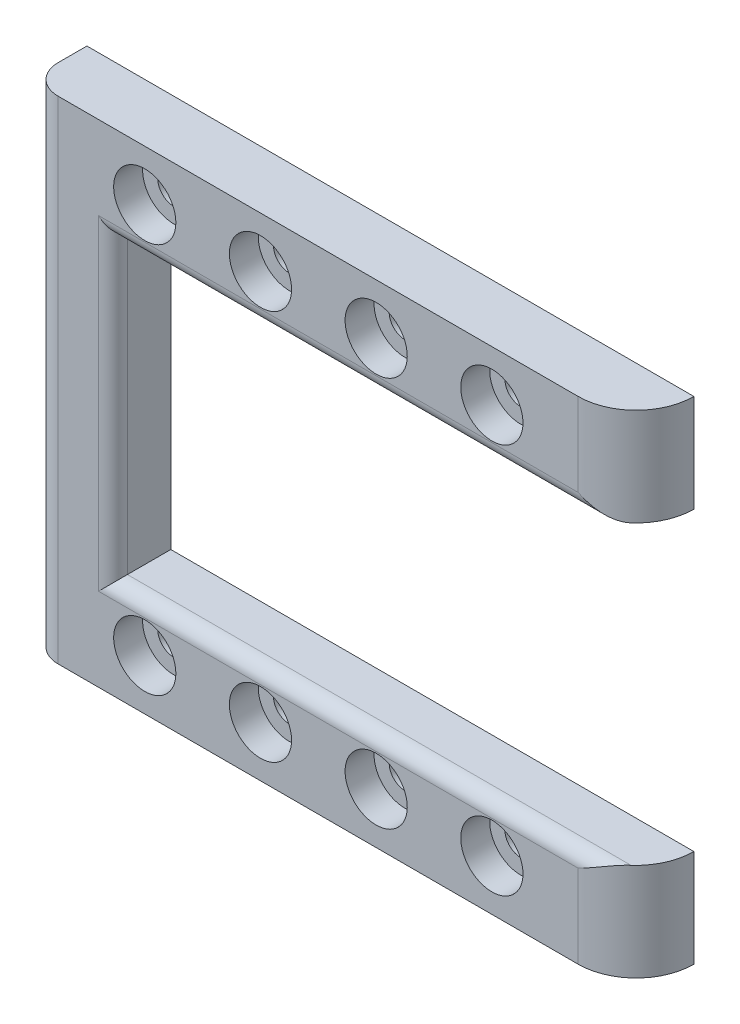
from build123d import *
from OCP.BRepFilletAPI import BRepFilletAPI_MakeFillet

# Parameters (mm, degrees)
SKETCH1_R           = 1.1
BOSS_EXTRUDE1_DEPTH = 4
SKETCH2_W           = 32.7
SKETCH2_H           = 20.5
CUT_EXTRUDE1_DEPTH  = 26.991585177
SKETCH3_R           = 2.15
CUT_EXTRUDE2_DEPTH  = 2
SKETCH6_W           = 4
SKETCH6_H           = 6.75
BOSS_EXTRUDE3_DEPTH = 3.47
FILLET1_R           = 4
FILLET1_R_2         = 2
FILLET1_R_3         = 1


with BuildPart() as part:
    # Sketch1 → Boss-Extrude1 (new body)
    with BuildSketch(Plane.XY):
        with BuildLine():
            Line((19.25, 17), (19.25, 5.6))
            ThreePointArc((19.25, 5.6), (13.65, 0), (19.25, -5.6))
            Line((19.25, -5.6), (19.25, -17))
            Line((19.25, -17), (-19.25, -17))
            Line((-19.25, -17), (-19.25, 17))
            Line((-19.25, 17), (19.25, 17))
        make_face()
        with Locations((12.75, 13.5)):
            Circle(SKETCH1_R, mode=Mode.SUBTRACT)
        with Locations((4.75, 13.5)):
            Circle(SKETCH1_R, mode=Mode.SUBTRACT)
        with Locations((-3.25, 13.5)):
            Circle(SKETCH1_R, mode=Mode.SUBTRACT)
        with Locations((-11.25, 13.5)):
            Circle(SKETCH1_R, mode=Mode.SUBTRACT)
        with Locations(Location((-11.25, -13.5, 0), (0, 0, 180))):
            Circle(SKETCH1_R, mode=Mode.SUBTRACT)
        with Locations(Location((-3.25, -13.5, 0), (0, 0, 180))):
            Circle(SKETCH1_R, mode=Mode.SUBTRACT)
        with Locations(Location((4.75, -13.5, 0), (0, 0, 180))):
            Circle(SKETCH1_R, mode=Mode.SUBTRACT)
        with Locations(Location((12.75, -13.5, 0), (0, 0, 180))):
            Circle(SKETCH1_R, mode=Mode.SUBTRACT)
    extrude(amount=BOSS_EXTRUDE1_DEPTH)

    # Sketch2 → Cut-Extrude1 (cut, through all)
    with BuildSketch(Plane.XY.offset(4)):
        with Locations((2.9, 0)):
            Rectangle(SKETCH2_W, SKETCH2_H)
    extrude(amount=-CUT_EXTRUDE1_DEPTH, mode=Mode.SUBTRACT)

    # Sketch3 → Cut-Extrude2 (cut)
    with BuildSketch(Plane.XY.offset(4)):
        with Locations((12.75, 13.5)):
            Circle(SKETCH3_R)
        with Locations((4.75, 13.5)):
            Circle(SKETCH3_R)
        with Locations((-3.25, 13.5)):
            Circle(SKETCH3_R)
        with Locations((-11.25, 13.5)):
            Circle(SKETCH3_R)
        with Locations((12.75, -13.5)):
            Circle(SKETCH3_R)
        with Locations((4.75, -13.5)):
            Circle(SKETCH3_R)
        with Locations((-3.25, -13.5)):
            Circle(SKETCH3_R)
        with Locations((-11.25, -13.5)):
            Circle(SKETCH3_R)
    extrude(amount=-CUT_EXTRUDE2_DEPTH, mode=Mode.SUBTRACT)

    # Sketch6 → Boss-Extrude3 (add)
    with BuildSketch(Plane(origin=(19.25, 0, 0), x_dir=(0, 0, -1), z_dir=(1, 0, 0))):
        with Locations((-2, -13.625)):
            Rectangle(SKETCH6_W, SKETCH6_H)
        with Locations((-2, 13.625)):
            Rectangle(SKETCH6_W, SKETCH6_H)
    extrude(amount=BOSS_EXTRUDE3_DEPTH)

    # Fillet1
    fillet1_edges_1 = [part.edges().sort_by_distance(p)[0] for p in [
        (22.72, 13.625, 4),
        (22.72, -13.625, 4),
    ]]
    fillet1_edges_2 = [part.edges().sort_by_distance(p)[0] for p in [
        (-19.25, 0, 4),
    ]]
    fillet1_edges_3 = [part.edges().sort_by_distance(p)[0] for p in [
        (4.635, 10.25, 4),
        (4.635, -10.25, 4),
        (-13.45, 0, 4),
    ]]
    fillet1 = BRepFilletAPI_MakeFillet(part.part.solid().wrapped)
    for e in fillet1_edges_1:
        fillet1.Add(FILLET1_R - 0.0001, e.wrapped)
    for e in fillet1_edges_2:
        fillet1.Add(FILLET1_R_2 - 0.0001, e.wrapped)
    for e in fillet1_edges_3:
        fillet1.Add(FILLET1_R_3 - 0.0001, e.wrapped)
    add(Compound.cast(fillet1.Shape()), mode=Mode.REPLACE)  # a hair under: the kernel refuses the full size


solid = part.part
